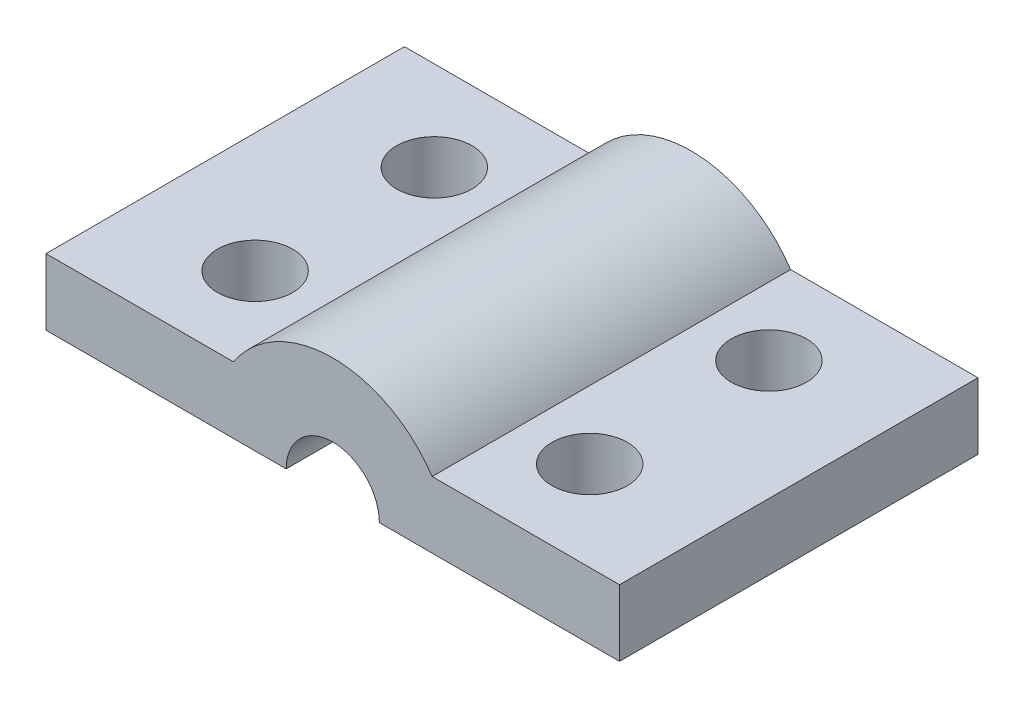
from build123d import *

# Parameters (mm, degrees)
BOSS_EXTRUDE1_DEPTH     = 7.5
SKETCH2_R               = 1.575
CUT_EXTRUDE1_DEPTH      = 15.420976523
MIRROR2_COPY_1_SKETCH_R = 1.575
MIRROR2_COPY_1_DEPTH    = 15.420976523


with BuildPart() as part:
    # Sketch1 → Boss-Extrude1 (new body)
    with BuildSketch(Plane.XY):
        with BuildLine():
            Line((-4.157575752, 2.777510373), (-12, 2.777510373))
            Line((-12, 2.777510373), (-12, 0))
            Line((-12, 0), (-1.95, 0))
            ThreePointArc((-1.95, 0), (0, 1.95), (1.95, 0))
            Line((1.95, 0), (12, 0))
            Line((12, 0), (12, 2.777510373))
            Line((12, 2.777510373), (4.157575752, 2.777510373))
            ThreePointArc((4.157575752, 2.777510373), (0, 5), (-4.157575752, 2.777510373))
        make_face()
    boss_extrude1 = extrude(amount=BOSS_EXTRUDE1_DEPTH)

    # Sketch2 → Cut-Extrude1 (cut, symmetric)
    with BuildSketch(Plane(origin=(0, 2.777510373, 0), x_dir=(1, 0, 0), z_dir=(0, 1, 0))):
        with Locations((-7, -3.75)):
            Circle(SKETCH2_R)
    cut_extrude1 = extrude(amount=CUT_EXTRUDE1_DEPTH, both=True, mode=Mode.SUBTRACT)

    # Mirror1: Cut-Extrude1 across plane
    add(cut_extrude1.mirror(Plane(origin=(0, 0, 0), x_dir=(0, 0, 1), z_dir=(1, 0, 0))), mode=Mode.SUBTRACT)

    # Mirror2: Boss-Extrude1, Cut-Extrude1 across plane
    add(boss_extrude1.mirror(Plane.XY))
    add(cut_extrude1.mirror(Plane.XY), mode=Mode.SUBTRACT)

    # Mirror2 copy 1 sketch → Mirror2 copy 1 (cut, symmetric)
    with BuildSketch(Plane(origin=(0, 2.777510373, 0), x_dir=(-1, 0, 0), z_dir=(0, 1, 0))):
        with Locations((-7, -3.75)):
            Circle(MIRROR2_COPY_1_SKETCH_R)
    extrude(amount=MIRROR2_COPY_1_DEPTH, both=True, mode=Mode.SUBTRACT)


solid = part.part
